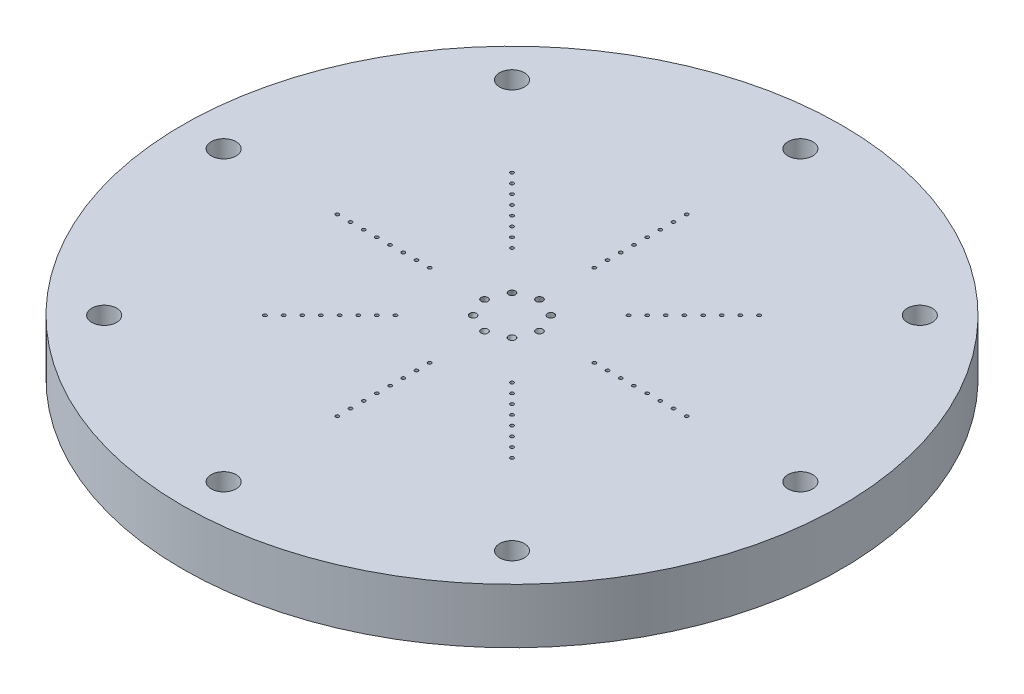
from build123d import *

# Parameters (mm, degrees)
SKETCH1_R                                      = 38.1
BOSS_EXTRUDE1_DEPTH                            = 6.35
CBORE_FOR_4_BUTTON_HEAD_CAP_SCREW1_D           = 2.8702
CBORE_FOR_4_BUTTON_HEAD_CAP_SCREW1_CBORE_D     = 4.826
CBORE_FOR_4_BUTTON_HEAD_CAP_SCREW1_CBORE_DEPTH = 1.905
CIRPATTERN1_COUNT                              = 8
SKETCH6_R                                      = 0.1984375
CUT_EXTRUDE1_DEPTH                             = 55.254423783
SKETCH7_R                                      = 0.396875
CIRPATTERN2_COUNT                              = 8


with BuildPart() as part:
    # Sketch1 → Boss-Extrude1 (new body)
    with BuildSketch(Plane(origin=(0, 0, 0), x_dir=(1, 0, 0), z_dir=(0, 1, 0))):
        Circle(SKETCH1_R)
    extrude(amount=BOSS_EXTRUDE1_DEPTH)

    # CBORE for #4 Button Head Cap Screw1 (through all)
    with Locations(Plane(origin=(0, 0, 0), x_dir=(-1, 0, 0), z_dir=(0, -1, 0))):
        with Locations((0, -33.3375)):
            cbore_for_4_button_head_cap_screw1 = CounterBoreHole(CBORE_FOR_4_BUTTON_HEAD_CAP_SCREW1_D / 2, CBORE_FOR_4_BUTTON_HEAD_CAP_SCREW1_CBORE_D / 2, CBORE_FOR_4_BUTTON_HEAD_CAP_SCREW1_CBORE_DEPTH)

    # CirPattern1: CBORE for #4 Button Head Cap Screw1 ×8 about axis
    cirpattern1_axis = Axis((0, 0, 0), (0, 1, 0))
    for i in range(1, CIRPATTERN1_COUNT):
        add(cbore_for_4_button_head_cap_screw1.rotate(cirpattern1_axis, i * 360 / CIRPATTERN1_COUNT), mode=Mode.SUBTRACT)

    # Sketch6 → Cut-Extrude1 (cut, through all)
    with BuildSketch(Plane(origin=(0, 6.35, 0), x_dir=(1, 0, 0), z_dir=(0, 1, 0))):
        with Locations((0, 9.525)):
            Circle(SKETCH6_R)
        with Locations((0, 11.049)):
            Circle(SKETCH6_R)
        with Locations((0, 12.573)):
            Circle(SKETCH6_R)
        with Locations((0, 14.097)):
            Circle(SKETCH6_R)
        with Locations((0, 15.621)):
            Circle(SKETCH6_R)
        with Locations((0, 17.145)):
            Circle(SKETCH6_R)
        with Locations((0, 18.669)):
            Circle(SKETCH6_R)
        with Locations((0, 20.193)):
            Circle(SKETCH6_R)
        with Locations((6.735192091, 6.735192091)):
            Circle(SKETCH6_R)
        with Locations((7.812822825, 7.812822825)):
            Circle(SKETCH6_R)
        with Locations((8.89045356, 8.89045356)):
            Circle(SKETCH6_R)
        with Locations((9.968084294, 9.968084294)):
            Circle(SKETCH6_R)
        with Locations((11.045715029, 11.045715029)):
            Circle(SKETCH6_R)
        with Locations((12.123345763, 12.123345763)):
            Circle(SKETCH6_R)
        with Locations((13.200976498, 13.200976498)):
            Circle(SKETCH6_R)
        with Locations((14.278607233, 14.278607233)):
            Circle(SKETCH6_R)
        with Locations((9.525, 0)):
            Circle(SKETCH6_R)
        with Locations((11.049, 0)):
            Circle(SKETCH6_R)
        with Locations((12.573, 0)):
            Circle(SKETCH6_R)
        with Locations((14.097, 0)):
            Circle(SKETCH6_R)
        with Locations((15.621, 0)):
            Circle(SKETCH6_R)
        with Locations((17.145, 0)):
            Circle(SKETCH6_R)
        with Locations((18.669, 0)):
            Circle(SKETCH6_R)
        with Locations((20.193, 0)):
            Circle(SKETCH6_R)
        with Locations((6.735192091, -6.735192091)):
            Circle(SKETCH6_R)
        with Locations((7.812822825, -7.812822825)):
            Circle(SKETCH6_R)
        with Locations((8.89045356, -8.89045356)):
            Circle(SKETCH6_R)
        with Locations((9.968084294, -9.968084294)):
            Circle(SKETCH6_R)
        with Locations((11.045715029, -11.045715029)):
            Circle(SKETCH6_R)
        with Locations((12.123345763, -12.123345763)):
            Circle(SKETCH6_R)
        with Locations((13.200976498, -13.200976498)):
            Circle(SKETCH6_R)
        with Locations((14.278607233, -14.278607232)):
            Circle(SKETCH6_R)
        with Locations((0, -9.525)):
            Circle(SKETCH6_R)
        with Locations((0, -11.049)):
            Circle(SKETCH6_R)
        with Locations((0, -12.573)):
            Circle(SKETCH6_R)
        with Locations((0, -14.097)):
            Circle(SKETCH6_R)
        with Locations((0, -15.621)):
            Circle(SKETCH6_R)
        with Locations((0, -17.145)):
            Circle(SKETCH6_R)
        with Locations((0, -18.669)):
            Circle(SKETCH6_R)
        with Locations((0, -20.193)):
            Circle(SKETCH6_R)
        with Locations((-6.735192091, -6.735192091)):
            Circle(SKETCH6_R)
        with Locations((-7.812822825, -7.812822825)):
            Circle(SKETCH6_R)
        with Locations((-8.89045356, -8.89045356)):
            Circle(SKETCH6_R)
        with Locations((-9.968084294, -9.968084294)):
            Circle(SKETCH6_R)
        with Locations((-11.045715029, -11.045715029)):
            Circle(SKETCH6_R)
        with Locations((-12.123345763, -12.123345763)):
            Circle(SKETCH6_R)
        with Locations((-13.200976498, -13.200976498)):
            Circle(SKETCH6_R)
        with Locations((-14.278607232, -14.278607233)):
            Circle(SKETCH6_R)
        with Locations((-9.525, 0)):
            Circle(SKETCH6_R)
        with Locations((-11.049, 0)):
            Circle(SKETCH6_R)
        with Locations((-12.573, 0)):
            Circle(SKETCH6_R)
        with Locations((-14.097, 0)):
            Circle(SKETCH6_R)
        with Locations((-15.621, 0)):
            Circle(SKETCH6_R)
        with Locations((-17.145, 0)):
            Circle(SKETCH6_R)
        with Locations((-18.669, 0)):
            Circle(SKETCH6_R)
        with Locations((-20.193, 0)):
            Circle(SKETCH6_R)
        with Locations((-6.735192091, 6.735192091)):
            Circle(SKETCH6_R)
        with Locations((-7.812822825, 7.812822825)):
            Circle(SKETCH6_R)
        with Locations((-8.89045356, 8.89045356)):
            Circle(SKETCH6_R)
        with Locations((-9.968084294, 9.968084294)):
            Circle(SKETCH6_R)
        with Locations((-11.045715029, 11.045715029)):
            Circle(SKETCH6_R)
        with Locations((-12.123345763, 12.123345763)):
            Circle(SKETCH6_R)
        with Locations((-13.200976498, 13.200976498)):
            Circle(SKETCH6_R)
        with Locations((-14.278607232, 14.278607232)):
            Circle(SKETCH6_R)
    extrude(amount=-CUT_EXTRUDE1_DEPTH, mode=Mode.SUBTRACT)

    # Cut-Sweep1: sweep along a curve in space
    with BuildLine() as cut_sweep1_path:
        Line((0, 6.35, -3.175), (0, 0, -4.7625))
    # Sketch7 → Cut-Sweep1 (sweep, cut)
    with BuildSketch(Plane(origin=(0, 6.35, 0), x_dir=(1, 0, 0), z_dir=(0, 1, 0))):
        with Locations((0, 3.175)):
            Circle(SKETCH7_R)
    cut_sweep1 = sweep(path=cut_sweep1_path.line, mode=Mode.SUBTRACT)

    # CirPattern2: Cut-Sweep1 ×8 about axis
    cirpattern2_axis = Axis((0, 6.35, 0), (0, 1, 0))
    for i in range(1, CIRPATTERN2_COUNT):
        add(cut_sweep1.rotate(cirpattern2_axis, i * 360 / CIRPATTERN2_COUNT), mode=Mode.SUBTRACT)


solid = part.part
